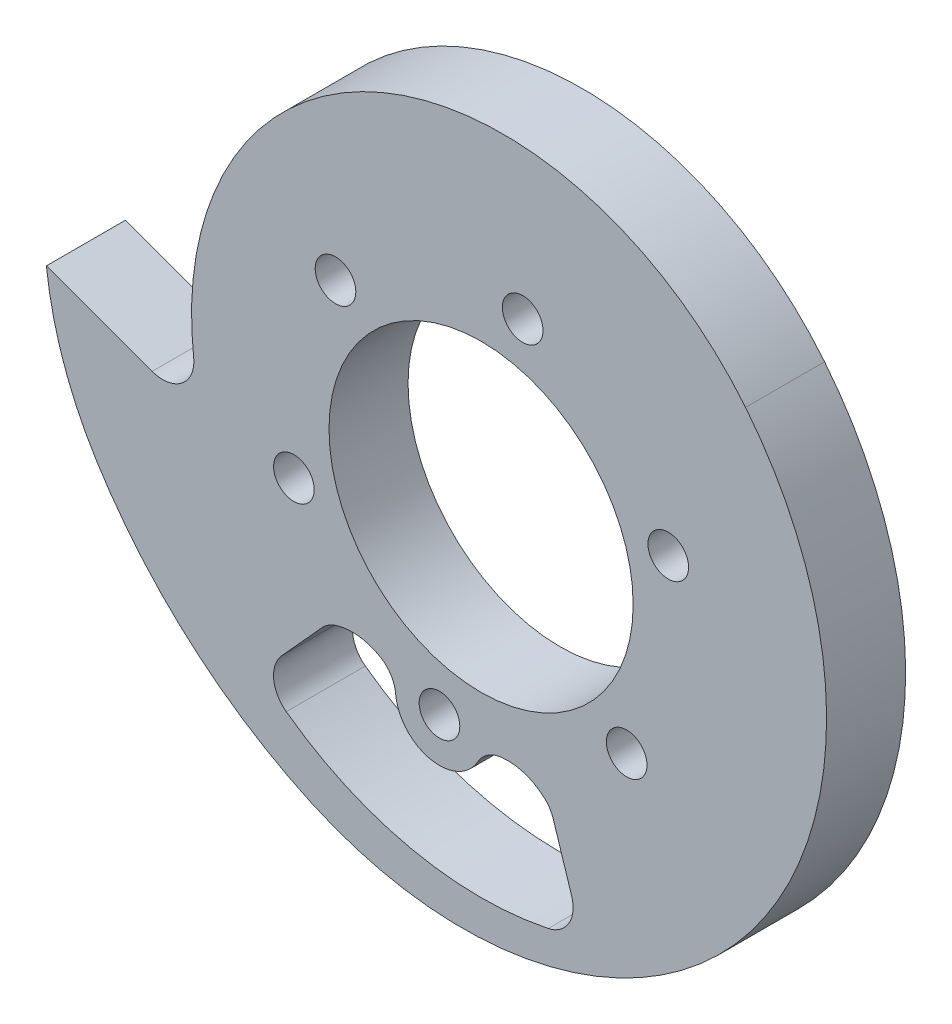
from build123d import *

# Parameters (mm, degrees)
SKETCH1_R               = 24.4376
BOSS_EXTRUDE1_DEPTH     = 6.35
FILLET3_R               = 5
F_1_4_CLEARANCE_HOLE1_D = 6.5278
CUT_EXTRUDE1_DEPTH      = 93.1558881
FILLET4_R               = 5


with BuildPart() as part:
    # Sketch1 → Boss-Extrude1 (new, symmetric)
    with BuildSketch(Plane.XY):
        with BuildLine():
            Line((-44.478299239, -9.23454387), (-69.85, 0))
            ThreePointArc((-69.85, 0), (-67.145808324, -11.931436066), (-61.877670839, -22.973109247))
            ThreePointArc((-61.877670839, -22.973109247), (-46.805768762, -40.769935967), (-27.239429984, -53.460391451))
            ThreePointArc((-27.239429984, -53.460391451), (43.261507742, -36.12453294), (42.494218543, 36.472474422))
            ThreePointArc((42.494218543, 36.472474422), (-19.738247715, 49.289742205), (-44.478299239, -9.23454387))
        make_face()
        Circle(SKETCH1_R, mode=Mode.SUBTRACT)
    extrude(amount=BOSS_EXTRUDE1_DEPTH, both=True)

    # Fillet3
    fillet3_edges = [part.edges().sort_by_distance(p)[0] for p in [
        (-44.478299239, -9.23454387, 0),
    ]]
    fillet(fillet3_edges, radius=FILLET3_R)

    # 1/4 Clearance Hole1 (through all)
    with Locations(Plane.XY.offset(6.35)):
        with Locations((-6.686125509, -30.871867443), (-30.078884223, -9.645579178), (-23.392758714, 21.226288265), (6.686125509, 30.871867443), (30.078884223, 9.645579178), (23.392758714, -21.226288265)):
            Hole(F_1_4_CLEARANCE_HOLE1_D / 2)

    # Sketch9 → Cut-Extrude1 (cut, through all)
    with BuildSketch(Plane.XY.offset(6.35)):
        with BuildLine():
            Line((-24.845137893, -27.415483573), (-35.589414475, -39.271305802))
            ThreePointArc((-35.589414475, -39.271305802), (-11.218157703, -51.797633342), (16.151966645, -50.477280588))
            Line((16.151966645, -50.477280588), (11.275764001, -35.238427358))
            ThreePointArc((11.275764001, -35.238427358), (6.140092391, -31.973907049), (0.113933666, -32.82103558))
            ThreePointArc((0.113933666, -32.82103558), (-8.183453043, -37.785482378), (-13.683307559, -29.832875351))
            ThreePointArc((-13.683307559, -29.832875351), (-18.818979168, -26.568355042), (-24.845137893, -27.415483573))
        make_face()
    extrude(amount=-CUT_EXTRUDE1_DEPTH, mode=Mode.SUBTRACT)

    # Fillet4
    fillet4_edges = [part.edges().sort_by_distance(p)[0] for p in [
        (16.151966645, -50.477280588, 0),
        (-35.589414475, -39.271305802, 0),
        (11.275764001, -35.238427358, 0),
        (-24.845137893, -27.415483573, 0),
        (-13.683307559, -29.832875351, 0),
        (0.113933666, -32.82103558, 0),
    ]]
    fillet(fillet4_edges, radius=FILLET4_R)


solid = part.part
